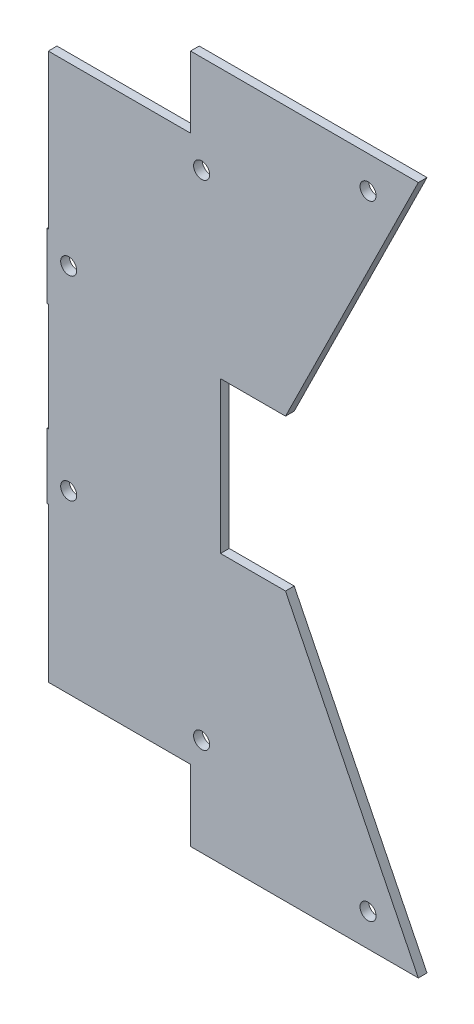
from build123d import *

# Parameters (mm, degrees)
SKETCH1_R           = 2.3495
BOSS_EXTRUDE1_DEPTH = 2.54


with BuildPart() as part:
    # Sketch1 → Boss-Extrude1 (new body)
    with BuildSketch(Plane.XY):
        Polygon((-2.930050059, -104.509781075), (-3.314938219, -104.509781075), (-3.314938219, -110.859781075), (-3.314938219, -123.559781075), (-2.930050059, -123.559781075), (-2.930050059, -168.708281075), (38.709428475, -168.708281075), (38.709428475, -189.536281075), (105.397061781, -189.536281075), (66.517436481, -110.859781075), (47.485061781, -110.859781075), (47.485061781, -104.509781075), (47.485061781, -72.886781075), (47.485061781, -66.536781075), (66.517436481, -66.536781075), (105.397061781, 12.139718925), (38.709428475, 12.139718925), (38.709428475, -8.688281075), (-2.930050059, -8.688281075), (-2.930050059, -53.836781075), (-3.314938219, -53.836781075), (-3.314938219, -66.536781075), (-3.314938219, -72.886781075), (-2.930050059, -72.886781075), align=None)
        with Locations((90.673911143, 2.614718925)):
            Circle(SKETCH1_R, mode=Mode.SUBTRACT)
        with Locations((41.95655448, -16.435281075)):
            Circle(SKETCH1_R, mode=Mode.SUBTRACT)
        with Locations((3.035061781, -60.186781075)):
            Circle(SKETCH1_R, mode=Mode.SUBTRACT)
        with Locations((3.035061781, -117.209781075)):
            Circle(SKETCH1_R, mode=Mode.SUBTRACT)
        with Locations((41.95655448, -160.961281075)):
            Circle(SKETCH1_R, mode=Mode.SUBTRACT)
        with Locations((90.673911143, -180.011281075)):
            Circle(SKETCH1_R, mode=Mode.SUBTRACT)
    extrude(amount=BOSS_EXTRUDE1_DEPTH)


solid = part.part
